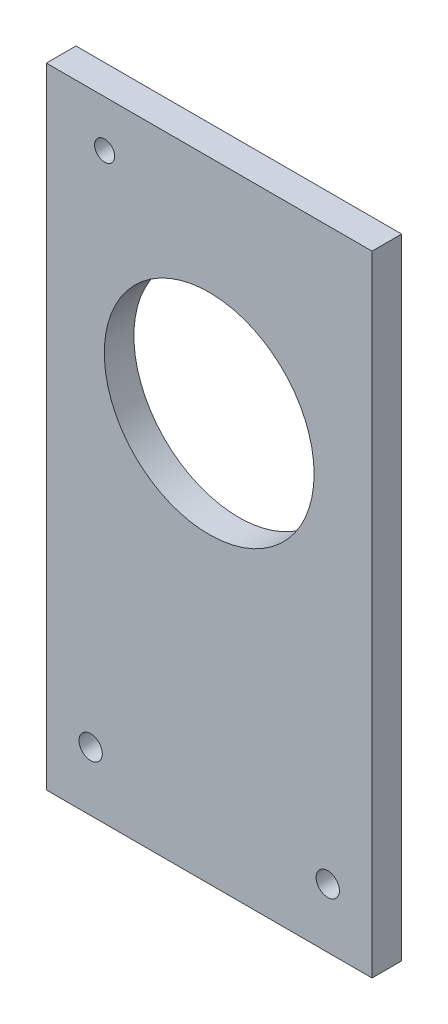
from build123d import *

# Parameters (mm, degrees)
SKETCH2_R               = 22.5
BOSS_EXTRUDE1_DEPTH     = 3.175
CUT_EXTRUDE1_DEPTH      = 140.588961329
CUT_EXTRUDE1_DEPTH_BACK = 140.588961329
SKETCH3_R               = 2.5
SKETCH3_R_2             = 2.15


with BuildPart() as part:
    # Sketch2 → Boss-Extrude1 (new, symmetric)
    with BuildSketch(Plane.XY):
        Polygon((-34.925, 0), (34.925, 0), (34.925, 87.4), (34.925, 119.9), (34.925, 135), (-34.925, 135), (-34.925, 119.9), (-34.925, 87.4), align=None)
        with Locations((0, 87.4)):
            Circle(SKETCH2_R, mode=Mode.SUBTRACT)
    extrude(amount=BOSS_EXTRUDE1_DEPTH, both=True)

    # Sketch3 → Cut-Extrude1 (cut, two sides: drawn at the far end of the back side and taken through both)
    with BuildSketch(Plane.XY.offset(3.175).offset(-CUT_EXTRUDE1_DEPTH_BACK)):
        with Locations((-25.425, 12.7)):
            Circle(SKETCH3_R)
        with Locations((25.425, 12.7)):
            Circle(SKETCH3_R)
        with Locations((-22.425, 125)):
            Circle(SKETCH3_R_2)
    extrude(amount=CUT_EXTRUDE1_DEPTH + CUT_EXTRUDE1_DEPTH_BACK, mode=Mode.SUBTRACT)


solid = part.part
